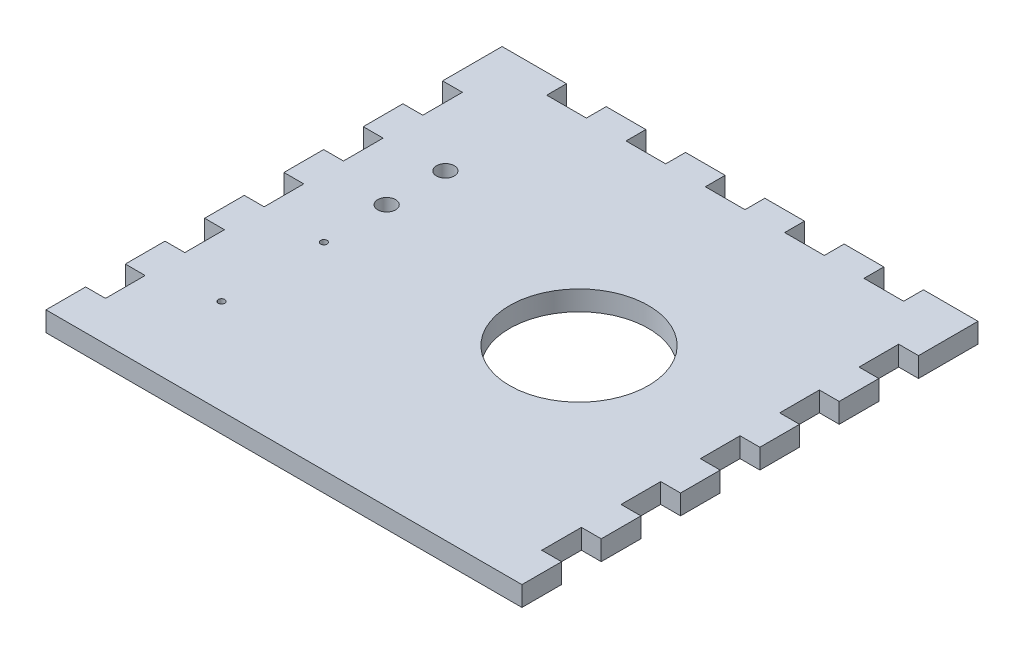
from build123d import *

# Parameters (mm, degrees)
SKETCH1_W               = 279.4
SKETCH1_H               = 279.4
BOSS_EXTRUDE1_DEPTH     = 12.7
SKETCH2_W               = 25.4
SKETCH2_H               = 12.7
BOSS_EXTRUDE2_DEPTH     = 12.7
LPATTERN1_COUNT         = 6
LPATTERN1_PITCH         = 50.8
MIRROR1_COPY_1_SKETCH_W = 25.4
MIRROR1_COPY_1_SKETCH_H = 12.7
MIRROR1_COPY_1_DEPTH    = 12.7
MIRROR1_COPY_2_SKETCH_W = 25.4
MIRROR1_COPY_2_SKETCH_H = 12.7
MIRROR1_COPY_2_DEPTH    = 12.7
MIRROR1_COPY_3_SKETCH_W = 25.4
MIRROR1_COPY_3_SKETCH_H = 12.7
MIRROR1_COPY_3_DEPTH    = 12.7
MIRROR1_COPY_4_SKETCH_W = 25.4
MIRROR1_COPY_4_SKETCH_H = 12.7
MIRROR1_COPY_4_DEPTH    = 12.7
MIRROR1_COPY_5_SKETCH_W = 25.4
MIRROR1_COPY_5_SKETCH_H = 12.7
MIRROR1_COPY_5_DEPTH    = 12.7
MIRROR1_COPY_6_SKETCH_W = 25.4
MIRROR1_COPY_6_SKETCH_H = 12.7
MIRROR1_COPY_6_DEPTH    = 12.7
SKETCH3_W               = 25.4
SKETCH3_H               = 12.7
BOSS_EXTRUDE3_DEPTH     = 12.7
LPATTERN2_COUNT         = 6
LPATTERN2_PITCH         = 50.8
SKETCH5_W               = 17.00363529
SKETCH5_H               = 12.7
BOSS_EXTRUDE4_DEPTH     = 12.7
SKETCH6_R               = 44.45
CUT_EXTRUDE1_DEPTH      = 216.9
SKETCH7_R               = 5.715
CUT_EXTRUDE2_DEPTH      = 216.9
SKETCH8_R               = 2.1
CUT_EXTRUDE3_DEPTH      = 216.9


with BuildPart() as part:
    # Sketch1 → Boss-Extrude1 (new body)
    with BuildSketch(Plane(origin=(0, 0, 0), x_dir=(1, 0, 0), z_dir=(0, 1, 0))):
        Rectangle(SKETCH1_W, SKETCH1_H)
    extrude(amount=BOSS_EXTRUDE1_DEPTH)

    # Sketch2 → Boss-Extrude2 (add)
    with BuildSketch(Plane(origin=(139.7, 0, 0), x_dir=(0, 0, -1), z_dir=(1, 0, 0))):
        with Locations((-127, 6.35)):
            Rectangle(SKETCH2_W, SKETCH2_H)
    boss_extrude2 = extrude(amount=BOSS_EXTRUDE2_DEPTH)

    # LPattern1: Boss-Extrude2 ×6
    with Locations(*[(0, 0, -i * LPATTERN1_PITCH) for i in range(1, LPATTERN1_COUNT)]):
        add(boss_extrude2)

    # Mirror1 copy 1 sketch → Mirror1 copy 1 (add)
    with BuildSketch(Plane(origin=(-139.7, 0, -50.8), x_dir=(0, 0, -1), z_dir=(-1, 0, 0))):
        with Locations((-127, -6.35)):
            Rectangle(MIRROR1_COPY_1_SKETCH_W, MIRROR1_COPY_1_SKETCH_H)
    extrude(amount=MIRROR1_COPY_1_DEPTH)

    # Mirror1 copy 2 sketch → Mirror1 copy 2 (add)
    with BuildSketch(Plane(origin=(-139.7, 0, -101.6), x_dir=(0, 0, -1), z_dir=(-1, 0, 0))):
        with Locations((-127, -6.35)):
            Rectangle(MIRROR1_COPY_2_SKETCH_W, MIRROR1_COPY_2_SKETCH_H)
    extrude(amount=MIRROR1_COPY_2_DEPTH)

    # Mirror1 copy 3 sketch → Mirror1 copy 3 (add)
    with BuildSketch(Plane(origin=(-139.7, 0, -152.4), x_dir=(0, 0, -1), z_dir=(-1, 0, 0))):
        with Locations((-127, -6.35)):
            Rectangle(MIRROR1_COPY_3_SKETCH_W, MIRROR1_COPY_3_SKETCH_H)
    extrude(amount=MIRROR1_COPY_3_DEPTH)

    # Mirror1 copy 4 sketch → Mirror1 copy 4 (add)
    with BuildSketch(Plane(origin=(-139.7, 0, -203.2), x_dir=(0, 0, -1), z_dir=(-1, 0, 0))):
        with Locations((-127, -6.35)):
            Rectangle(MIRROR1_COPY_4_SKETCH_W, MIRROR1_COPY_4_SKETCH_H)
    extrude(amount=MIRROR1_COPY_4_DEPTH)

    # Mirror1 copy 5 sketch → Mirror1 copy 5 (add)
    with BuildSketch(Plane(origin=(-139.7, 0, -254), x_dir=(0, 0, -1), z_dir=(-1, 0, 0))):
        with Locations((-127, -6.35)):
            Rectangle(MIRROR1_COPY_5_SKETCH_W, MIRROR1_COPY_5_SKETCH_H)
    extrude(amount=MIRROR1_COPY_5_DEPTH)

    # Mirror1 copy 6 sketch → Mirror1 copy 6 (add)
    with BuildSketch(Plane(origin=(-139.7, 0, 0), x_dir=(0, 0, -1), z_dir=(-1, 0, 0))):
        with Locations((-127, -6.35)):
            Rectangle(MIRROR1_COPY_6_SKETCH_W, MIRROR1_COPY_6_SKETCH_H)
    extrude(amount=MIRROR1_COPY_6_DEPTH)

    # Sketch3 → Boss-Extrude3 (add)
    with BuildSketch(Plane(origin=(0, 0, -139.7), x_dir=(-1, 0, 0), z_dir=(0, 0, -1))):
        with Locations((-130.175, 6.35)):
            Rectangle(SKETCH3_W, SKETCH3_H)
    boss_extrude3 = extrude(amount=BOSS_EXTRUDE3_DEPTH)

    # LPattern2: Boss-Extrude3 ×6
    with Locations(*[(-i * LPATTERN2_PITCH, 0, 0) for i in range(1, LPATTERN2_COUNT)]):
        add(boss_extrude3)

    # Sketch5 → Boss-Extrude4 (add)
    with BuildSketch(Plane(origin=(0, 0, -139.7), x_dir=(-1, 0, 0), z_dir=(0, 0, -1))):
        with Locations((-143.898182355, 6.35)):
            Rectangle(SKETCH5_W, SKETCH5_H)
    boss_extrude4 = extrude(amount=BOSS_EXTRUDE4_DEPTH)

    # Mirror2: Boss-Extrude4 across plane
    add(boss_extrude4.mirror(Plane(origin=(0, 0, 0), x_dir=(0, 0, 1), z_dir=(1, 0, 0))))

    # Sketch6 → Cut-Extrude1 (cut, through all)
    with BuildSketch(Plane(origin=(0, 12.7, 0), x_dir=(1, 0, 0), z_dir=(0, 1, 0))):
        with Locations((38.1, 11.176)):
            Circle(SKETCH6_R)
    extrude(amount=-CUT_EXTRUDE1_DEPTH, mode=Mode.SUBTRACT)

    # Sketch7 → Cut-Extrude2 (cut, through all)
    with BuildSketch(Plane(origin=(0, 12.7, 0), x_dir=(1, 0, 0), z_dir=(0, 1, 0))):
        with Locations((-101.6, 65.278)):
            Circle(SKETCH7_R)
        with Locations((-101.6, 27.686)):
            Circle(SKETCH7_R)
    extrude(amount=-CUT_EXTRUDE2_DEPTH, mode=Mode.SUBTRACT)

    # Sketch8 → Cut-Extrude3 (cut, through all)
    with BuildSketch(Plane(origin=(0, 12.7, 0), x_dir=(1, 0, 0), z_dir=(0, 1, 0))):
        with Locations((-100.9, -78.811081859)):
            Circle(SKETCH8_R)
        with Locations((-100.9, -13.203881859)):
            Circle(SKETCH8_R)
    extrude(amount=-CUT_EXTRUDE3_DEPTH, mode=Mode.SUBTRACT)


solid = part.part
